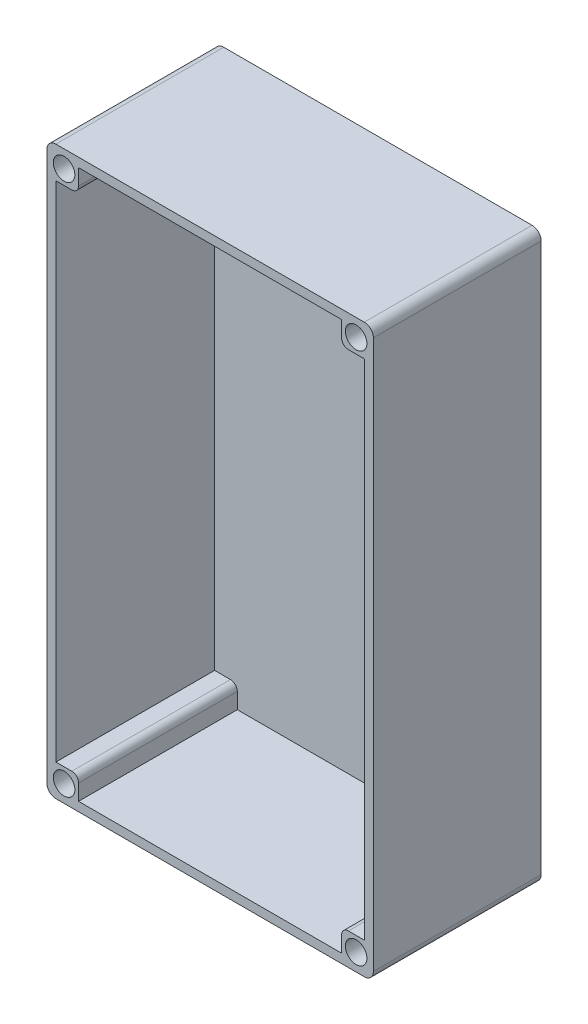
from build123d import *

# Parameters (mm, degrees)
SKETCH1_W            = 72
SKETCH1_H            = 125
BOSS_EXTRUDE1_DEPTH  = 2
SKETCH5_W            = 72
SKETCH5_H            = 2
BOSS_EXTRUDE3_DEPTH  = 35
SKETCH6_W            = 2
SKETCH6_H            = 125
BOSS_EXTRUDE4_DEPTH  = 35
SKETCH7_W            = 5
SKETCH7_H            = 5
BOSS_EXTRUDE5_DEPTH  = 35
FILLET2_R            = 1.5
SKETCH8_R            = 2.375
CUT_EXTRUDE2_DEPTH   = 92.049437121
FILLET2_OF_MIRROR4_R = 1.5
FILLET3_R            = 2
SKETCH12_W           = 68
SKETCH12_H           = 2
BOSS_EXTRUDE6_DEPTH  = 35
SKETCH13_W           = 5
SKETCH13_H           = 5
BOSS_EXTRUDE9_DEPTH  = 35
SKETCH14_R           = 2.375
CUT_EXTRUDE6_DEPTH   = 92.049437121
FILLET4_R            = 1.5
FILLET4_OF_MIRROR8_R = 1.5


with BuildPart() as part:
    # Sketch1 → Boss-Extrude1 (new body)
    with BuildSketch(Plane.XY):
        with Locations((0, -12.5)):
            Rectangle(SKETCH1_W, SKETCH1_H)
    extrude(amount=BOSS_EXTRUDE1_DEPTH)

    # Sketch5 → Boss-Extrude3 (add)
    with BuildSketch(Plane.XY.offset(2)):
        with Locations((0, 49)):
            Rectangle(SKETCH5_W, SKETCH5_H)
    extrude(amount=BOSS_EXTRUDE3_DEPTH)

    # Sketch6 → Boss-Extrude4 (add)
    with BuildSketch(Plane.XY.offset(2)):
        with Locations((-35, -12.5)):
            Rectangle(SKETCH6_W, SKETCH6_H)
    boss_extrude4 = extrude(amount=BOSS_EXTRUDE4_DEPTH)

    # Mirror2: Boss-Extrude4 across plane
    add(boss_extrude4.mirror(Plane(origin=(0, 0, 0), x_dir=(0, 0, 1), z_dir=(1, 0, 0))))

    # Sketch7 → Boss-Extrude5 (add)
    with BuildSketch(Plane.XY.offset(2)):
        with Locations((-31.5, 45.5)):
            Rectangle(SKETCH7_W, SKETCH7_H)
    boss_extrude5 = extrude(amount=BOSS_EXTRUDE5_DEPTH)

    # Fillet2
    fillet2_edges = [part.edges().sort_by_distance(p)[0] for p in [
        (-29, 43, 19.5),
    ]]
    fillet(fillet2_edges, radius=FILLET2_R)

    # Sketch8 → Cut-Extrude2 (cut, through all)
    with BuildSketch(Plane.XY.offset(37)):
        with Locations((-32.2, 46.2)):
            Circle(SKETCH8_R)
    cut_extrude2 = extrude(amount=-CUT_EXTRUDE2_DEPTH, mode=Mode.SUBTRACT)

    # Mirror4: Boss-Extrude5, Cut-Extrude2 across plane
    add(boss_extrude5.mirror(Plane(origin=(0, 0, 0), x_dir=(0, 0, 1), z_dir=(1, 0, 0))))
    add(cut_extrude2.mirror(Plane(origin=(0, 0, 0), x_dir=(0, 0, 1), z_dir=(1, 0, 0))), mode=Mode.SUBTRACT)

    # Fillet2 of Mirror4
    fillet2_of_mirror4_edges = [part.edges().sort_by_distance(p)[0] for p in [
        (29, 43, 19.5),
    ]]
    fillet(fillet2_of_mirror4_edges, radius=FILLET2_OF_MIRROR4_R)

    # Fillet3
    fillet3_edges = [part.edges().sort_by_distance(p)[0] for p in [
        (-36, 50, 18.5),
        (36, 50, 18.5),
        (-36, -75, 18.5),
        (36, -75, 18.5),
    ]]
    fillet(fillet3_edges, radius=FILLET3_R - 0.0001)  # a hair under: the kernel refuses the full size

    # Sketch12 → Boss-Extrude6 (add)
    with BuildSketch(Plane.XY.offset(2)):
        with Locations((0, -74)):
            Rectangle(SKETCH12_W, SKETCH12_H)
    extrude(amount=BOSS_EXTRUDE6_DEPTH)

    # Sketch13 → Boss-Extrude9 (add)
    with BuildSketch(Plane.XY.offset(37)):
        with Locations((-31.5, -70.5)):
            Rectangle(SKETCH13_W, SKETCH13_H)
    boss_extrude9 = extrude(amount=-BOSS_EXTRUDE9_DEPTH)

    # Sketch14 → Cut-Extrude6 (cut, through all)
    with BuildSketch(Plane.XY.offset(37)):
        with Locations((-32.2, -71.2)):
            Circle(SKETCH14_R)
    cut_extrude6 = extrude(amount=-CUT_EXTRUDE6_DEPTH, mode=Mode.SUBTRACT)

    # Fillet4
    fillet4_edges = [part.edges().sort_by_distance(p)[0] for p in [
        (-29, -68, 19.5),
    ]]
    fillet(fillet4_edges, radius=FILLET4_R)

    # Mirror8: Boss-Extrude9, Cut-Extrude6 across plane
    add(boss_extrude9.mirror(Plane(origin=(0, 0, 0), x_dir=(0, 0, 1), z_dir=(1, 0, 0))))
    add(cut_extrude6.mirror(Plane(origin=(0, 0, 0), x_dir=(0, 0, 1), z_dir=(1, 0, 0))), mode=Mode.SUBTRACT)

    # Fillet4 of Mirror8
    fillet4_of_mirror8_edges = [part.edges().sort_by_distance(p)[0] for p in [
        (29, -68, 19.5),
    ]]
    fillet(fillet4_of_mirror8_edges, radius=FILLET4_OF_MIRROR8_R)


solid = part.part
